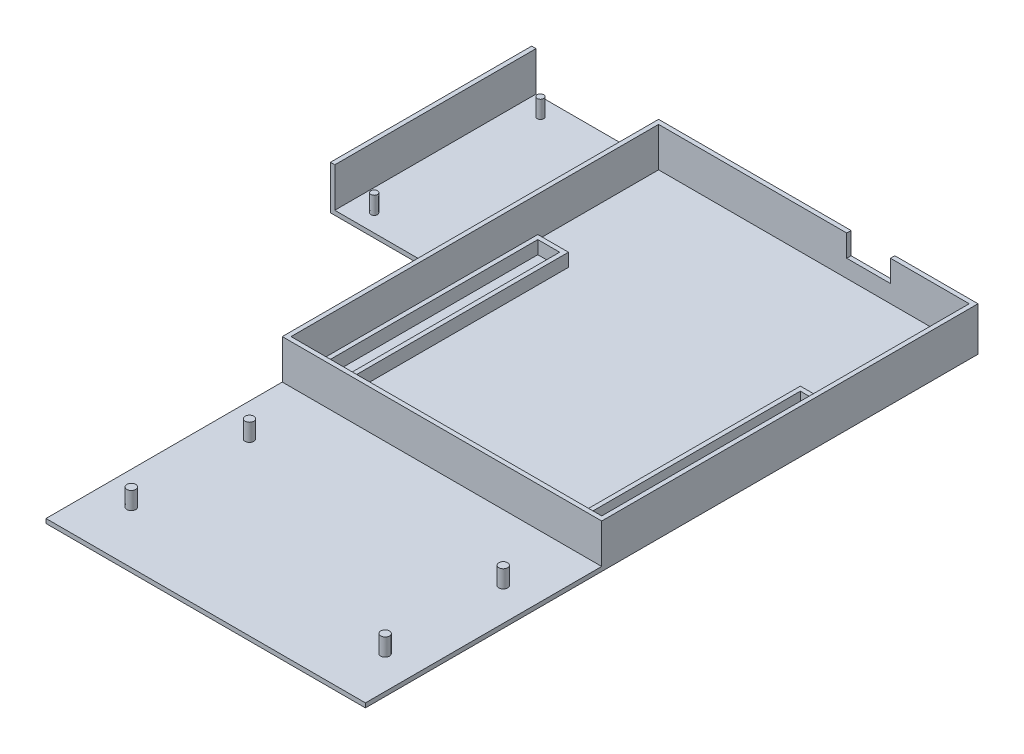
from build123d import *

# Parameters (mm, degrees)
SKETCH_1_R          = 1
SKETCH_1_R_2        = 0.75
EXTRUDE_1_DEPTH     = 1
SKETCH_1_3_W        = 73
SKETCH_1_3_H        = 86
SKETCH_1_3_W_2      = 71
SKETCH_1_3_H_2      = 84
SKETCH_1_3_W_3      = 1
SKETCH_1_3_H_3      = 46
EXTRUDE_2_DEPTH     = 10
SKETCH_1_4_W        = 7
SKETCH_1_4_H        = 52
SKETCH_1_4_W_2      = 5
SKETCH_1_4_H_2      = 50
EXTRUDE_3_DEPTH     = 4
SKETCH_1_5_R        = 1
SKETCH_1_5_R_2      = 0.75
EXTRUDE_4_DEPTH     = 5
SKETCH_2_W          = 10
SKETCH_2_H          = 5
CUT_EXTRUDE_2_DEPTH = 10


with BuildPart() as part:
    # Эскиз1 → Бобышка-Вытянуть1 (new body)
    with BuildSketch(Plane(origin=(0, 0, 0), x_dir=(1, 0, 0), z_dir=(0, 1, 0))):
        Polygon((-29, 85), (-29, 39), (-1, 39), (-1, -55), (72, -55), (72, 85), align=None)
        with Locations((64.5, -16)):
            Circle(SKETCH_1_R, mode=Mode.SUBTRACT)
        with Locations((64.5, -43)):
            Circle(SKETCH_1_R, mode=Mode.SUBTRACT)
        with Locations((6.5, -43)):
            Circle(SKETCH_1_R, mode=Mode.SUBTRACT)
        with Locations((6.5, -16)):
            Circle(SKETCH_1_R, mode=Mode.SUBTRACT)
        with Locations((-4, 81)):
            Circle(SKETCH_1_R_2, mode=Mode.SUBTRACT)
        with Locations((-24, 43)):
            Circle(SKETCH_1_R_2, mode=Mode.SUBTRACT)
        with Locations((-4, 43)):
            Circle(SKETCH_1_R_2, mode=Mode.SUBTRACT)
        with Locations((-24, 81)):
            Circle(SKETCH_1_R_2, mode=Mode.SUBTRACT)
    extrude(amount=EXTRUDE_1_DEPTH)

    # Эскиз1<3> → Бобышка-Вытянуть2 (add)
    # profile 1 of 2: a face of its own
    with BuildSketch(Plane(origin=(0, 0, 0), x_dir=(1, 0, 0), z_dir=(0, 1, 0))):
        with Locations((35.5, 42)):
            Rectangle(SKETCH_1_3_W, SKETCH_1_3_H)
        with Locations((35.5, 42)):
            Rectangle(SKETCH_1_3_W_2, SKETCH_1_3_H_2, mode=Mode.SUBTRACT)
    # profile 2 of 2: a face of its own
    with BuildSketch(Plane(origin=(0, 0, 0), x_dir=(1, 0, 0), z_dir=(0, 1, 0))):
        with Locations((-29.5, 62)):
            Rectangle(SKETCH_1_3_W_3, SKETCH_1_3_H_3)
    extrude(amount=EXTRUDE_2_DEPTH)

    # Эскиз1<4> → Бобышка-Вытянуть3 (add)
    # profile 1 of 2: a face of its own
    with BuildSketch(Plane(origin=(0, 0, 0), x_dir=(1, 0, 0), z_dir=(0, 1, 0))):
        with Locations((5.5, 28.4)):
            Rectangle(SKETCH_1_4_W, SKETCH_1_4_H)
        with Locations((5.5, 28.4)):
            Rectangle(SKETCH_1_4_W_2, SKETCH_1_4_H_2, mode=Mode.SUBTRACT)
    # profile 2 of 2: a face of its own
    with BuildSketch(Plane(origin=(0, 0, 0), x_dir=(1, 0, 0), z_dir=(0, 1, 0))):
        with Locations((65.5, 28.4)):
            Rectangle(SKETCH_1_4_W, SKETCH_1_4_H)
        with Locations((65.5, 28.4)):
            Rectangle(SKETCH_1_4_W_2, SKETCH_1_4_H_2, mode=Mode.SUBTRACT)
    extrude(amount=EXTRUDE_3_DEPTH)

    # Эскиз1<5> → Бобышка-Вытянуть4 (add)
    with BuildSketch(Plane(origin=(0, 0, 0), x_dir=(1, 0, 0), z_dir=(0, 1, 0))):
        with Locations((6.5, -16)):
            Circle(SKETCH_1_5_R)
        with Locations((64.5, -16)):
            Circle(SKETCH_1_5_R)
        with Locations((64.5, -43)):
            Circle(SKETCH_1_5_R)
        with Locations((6.5, -43)):
            Circle(SKETCH_1_5_R)
        with Locations((-24, 81)):
            Circle(SKETCH_1_5_R_2)
        with Locations((-4, 81)):
            Circle(SKETCH_1_5_R_2)
        with Locations((-24, 43)):
            Circle(SKETCH_1_5_R_2)
        with Locations((-4, 43)):
            Circle(SKETCH_1_5_R_2)
    extrude(amount=EXTRUDE_4_DEPTH)

    # Эскиз2 → Вырез-Вытянуть2 (cut)
    with BuildSketch(Plane.XY.offset(-84)):
        with Locations((48, 7.5)):
            Rectangle(SKETCH_2_W, SKETCH_2_H)
    extrude(amount=-CUT_EXTRUDE_2_DEPTH, mode=Mode.SUBTRACT)


solid = part.part
